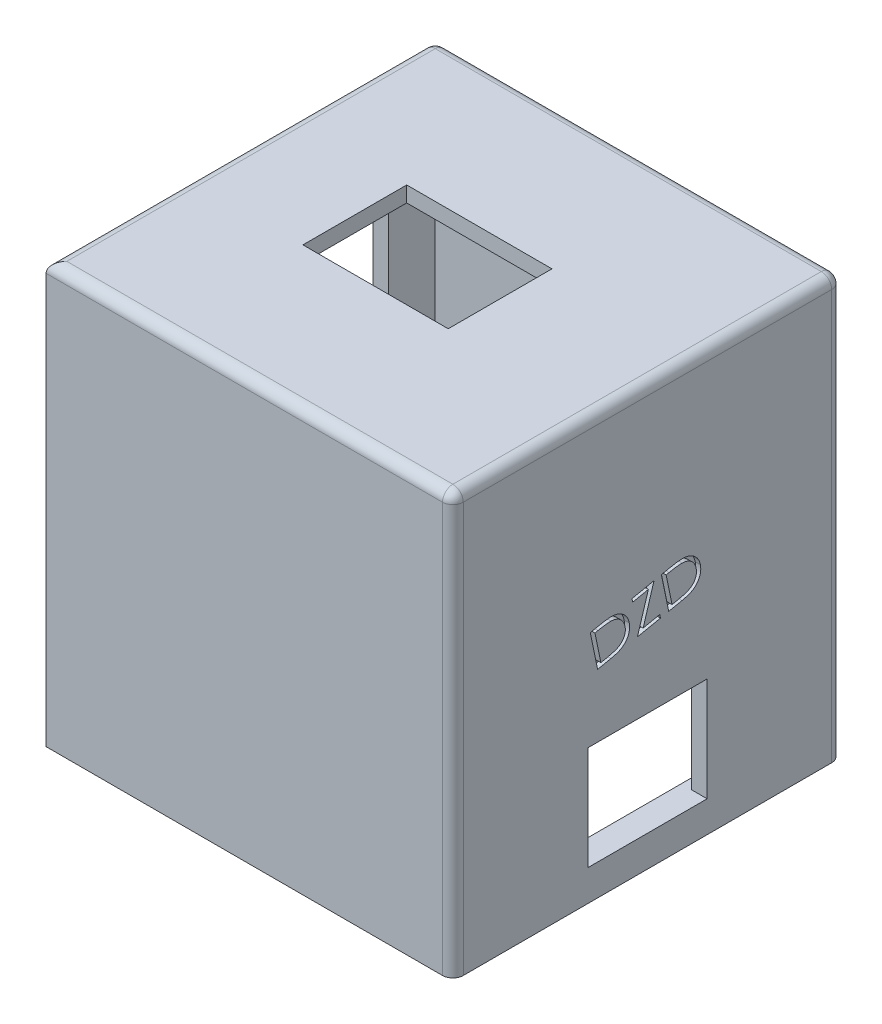
from build123d import *

# Parameters (mm, degrees)
SKETCH_1_W               = 39.2
SKETCH_1_H               = 37.5
EXTRUDE_1_DEPTH          = 40.5
SHELL_1_T                = -1.5
SKETCH_4_W               = 14
SKETCH_4_H               = 10
CUT_EXTRUDE_1_DEPTH      = 1.5
SKETCH_5_W               = 25.5
SKETCH_5_H               = 18
CUT_EXTRUDE_2_DEPTH      = 5.5
SKETCH_6_W               = 11.5
SKETCH_6_H               = 10
CUT_EXTRUDE_3_DEPTH      = 5.5
SKETCH_12_W              = 36.2
SKETCH_12_H              = 34.5
SKETCH_12_W_2            = 34.2
SKETCH_12_H_2            = 32.5
EXTRUDE_4_DEPTH          = 1.5
SKETCH_13_R              = 0.9
EXTRUDE_5_DEPTH          = 1.5
WRAP_START               = -0.5
WRAP_1_DEPTH             = 0.5
FILLET_1_R               = 1
WRAP_2_DEPTH             = 0.5
HOLE_WIZARD_M1_6_2_D     = 1.25
HOLE_WIZARD_M1_6_2_DEPTH = 4.25
HOLE_WIZARD_M1_6_2_TIP   = 0.375537887


# Read off the part's stored shape, not the designer's step: 包覆1, 包覆2
with BuildPart() as part:
    # 草图1 → 凸台-拉伸1 (new body)
    with BuildSketch(Plane(origin=(0, 0, 0), x_dir=(1, 0, 0), z_dir=(0, 1, 0))):
        Rectangle(SKETCH_1_W, SKETCH_1_H)
    extrude(amount=EXTRUDE_1_DEPTH)

    # 抽壳1
    shell_1_openings = [part.faces().sort_by_distance(p)[0] for p in [
        (0, 0, 0),
    ]]
    offset(amount=SHELL_1_T, openings=shell_1_openings, kind=Kind.INTERSECTION)

    # 草图4 → 切除-拉伸1 (cut)
    with BuildSketch(Plane(origin=(0, 40.5, 0), x_dir=(1, 0, 0), z_dir=(0, 1, 0))):
        with Locations((-1.6, 0)):
            Rectangle(SKETCH_4_W, SKETCH_4_H)
    extrude(amount=-CUT_EXTRUDE_1_DEPTH, mode=Mode.SUBTRACT)

    # 草图5 → 切除-拉伸2 (cut)
    with BuildSketch(Plane.ZY.offset(19.6)):
        with Locations((0, 24.5)):
            Rectangle(SKETCH_5_W, SKETCH_5_H)
    extrude(amount=-CUT_EXTRUDE_2_DEPTH, mode=Mode.SUBTRACT)

    # 草图6 → 切除-拉伸3 (cut)
    with BuildSketch(Plane(origin=(19.6, 0, 0), x_dir=(0, 0, -1), z_dir=(1, 0, 0))):
        with Locations((0, 8)):
            Rectangle(SKETCH_6_W, SKETCH_6_H)
    extrude(amount=-CUT_EXTRUDE_3_DEPTH, mode=Mode.SUBTRACT)

    # 草图12 → 凸台-拉伸4 (add)
    with BuildSketch(Plane(origin=(0, 1.5, 0), x_dir=(-1, 0, 0), z_dir=(0, 1, 0))):
        Rectangle(SKETCH_12_W, SKETCH_12_H)
        Rectangle(SKETCH_12_W_2, SKETCH_12_H_2, mode=Mode.SUBTRACT)
    extrude(amount=EXTRUDE_4_DEPTH)

    # 草图13 → 凸台-拉伸5 (add)
    with BuildSketch(Plane(origin=(0, 1.5, 0), x_dir=(-1, 0, 0), z_dir=(0, 1, 0))):
        with Locations((17.1, 16.25)):
            Circle(SKETCH_13_R)
        with Locations((-17.1, 16.25)):
            Circle(SKETCH_13_R)
        with Locations((-17.1, -16.25)):
            Circle(SKETCH_13_R)
        with Locations((17.1, -16.25)):
            Circle(SKETCH_13_R)
    extrude(amount=EXTRUDE_5_DEPTH)

    # 包覆1 outline → 包覆1 (cut)
    # profile 1 of 11: a face of its own
    with BuildSketch(Plane.ZY.offset(19.6).offset(WRAP_START)):
        with BuildLine():
            add(Edge.make_bspline(
                [(2.708361644, 9.748047717), (2.755102772, 9.747892131), (2.844850917, 9.747593389), (2.973424187, 9.745927626), (3.090251284, 9.74115327), (3.195271123, 9.737044687), (3.288481778, 9.729552746), (3.370169069, 9.722392099), (3.439956766, 9.713018438), (3.482202618, 9.704313015), (3.501330394, 9.700371435)],
                knots=[0, 0, 0, 0, 0.176257755, 0.338434414, 0.484822051, 0.617157578, 0.734698361, 0.837385184, 0.926372421, 1, 1, 1, 1], degree=3))
            Line((2.708361644, 9.748047717), (2.007940971, 9.748047717))
            Line((2.007940971, 9.748047717), (2.007940971, 6.248047717))
            Line((2.007940971, 6.248047717), (2.322043535, 6.248047717))
            Line((2.322043535, 6.248047717), (2.322043535, 7.863432333))
            Line((2.322043535, 7.863432333), (2.577251868, 7.863432333))
            Line((2.577251868, 7.863432333), (3.86310924, 6.248047717))
            Line((3.86310924, 6.248047717), (4.251530714, 6.248047717))
            Line((4.251530714, 6.248047717), (2.965673342, 7.863432333))
            add(Edge.make_bspline(
                [(4.206658919, 8.812050121), (4.205189921, 8.765415017), (4.202323525, 8.674417849), (4.175598422, 8.542356967), (4.131821902, 8.419167653), (4.071498613, 8.305005015), (3.994679137, 8.202094369), (3.902354346, 8.111703914), (3.794472735, 8.036064002), (3.694043419, 7.983611197), (3.605329219, 7.950018288), (3.532295906, 7.926381929), (3.452628929, 7.908119964), (3.367091594, 7.891759832), (3.275327939, 7.879408138), (3.177557899, 7.870361543), (3.073711748, 7.864707495), (3.002372678, 7.86386549), (2.965673342, 7.863432333)],
                knots=[0, 0, 0, 0, 0.078780236, 0.153720644, 0.22671353, 0.299191166, 0.371189997, 0.443006414, 0.516689173, 0.593217217, 0.633872918, 0.676989142, 0.722899506, 0.771958611, 0.824211323, 0.879378651, 0.937948119, 1, 1, 1, 1], degree=3))
            add(Edge.make_bspline(
                [(3.501330394, 9.700371435), (3.526937018, 9.69404467), (3.577604007, 9.681526106), (3.650554073, 9.655066506), (3.720068397, 9.624446881), (3.785858222, 9.588483161), (3.847594013, 9.546908381), (3.905912324, 9.500440258), (3.961077787, 9.449333053), (4.010859417, 9.392298211), (4.057798469, 9.332461702), (4.097387095, 9.267757945), (4.131513575, 9.200096417), (4.158684092, 9.128788999), (4.180562065, 9.054527228), (4.195988305, 8.976638431), (4.205239492, 8.895477456), (4.206181348, 8.840119547), (4.206658919, 8.812050121)],
                knots=[0, 0, 0, 0, 0.064216843, 0.127063766, 0.188744538, 0.249132103, 0.309452533, 0.369826676, 0.430650142, 0.492351932, 0.554072106, 0.615689784, 0.676797703, 0.738439048, 0.80131691, 0.865184512, 0.931641324, 1, 1, 1, 1], degree=3))
        make_face()
        with BuildLine():
            add(Edge.make_bspline(
                [(2.962868855, 8.217498839), (2.992788894, 8.217485603), (3.050782451, 8.217459946), (3.134683116, 8.221453722), (3.212803228, 8.225997041), (3.28484398, 8.232946386), (3.350837555, 8.241902458), (3.410750968, 8.253105442), (3.46468202, 8.266157505), (3.527580559, 8.286359131), (3.59781709, 8.318365149), (3.67414855, 8.364930648), (3.739150888, 8.423499767), (3.79406875, 8.490473223), (3.838198181, 8.564109472), (3.869310236, 8.643525841), (3.889052678, 8.726717439), (3.891381224, 8.783895547), (3.892556355, 8.812751243)],
                knots=[0, 0, 0, 0, 0.07166815, 0.138913286, 0.20118457, 0.259124428, 0.312255041, 0.36068151, 0.405086143, 0.445101659, 0.51877778, 0.589461579, 0.658462242, 0.727283218, 0.796322487, 0.863174893, 0.930949381, 1, 1, 1, 1], degree=3))
            Line((2.962868855, 8.217498839), (2.322043535, 8.222406692))
            Line((2.322043535, 8.222406692), (2.322043535, 9.389073358))
            Line((2.322043535, 9.389073358), (2.978293535, 9.389073358))
            add(Edge.make_bspline(
                [(3.892556355, 8.812751243), (3.891354234, 8.840897817), (3.888972069, 8.896674055), (3.8695233, 8.978329966), (3.836633919, 9.055396916), (3.792311681, 9.127561401), (3.738312526, 9.193067137), (3.674994713, 9.24911429), (3.604089518, 9.295363754), (3.53781832, 9.324918135), (3.478584107, 9.343037988), (3.427154447, 9.355789152), (3.369042969, 9.366033621), (3.303967511, 9.374241682), (3.23220588, 9.381296626), (3.153395229, 9.386048405), (3.068058449, 9.388862269), (3.008911518, 9.389001358), (2.978293535, 9.389073358)],
                knots=[0, 0, 0, 0, 0.068814296, 0.136364825, 0.204019354, 0.273063739, 0.34291332, 0.410965444, 0.479168767, 0.549308007, 0.587651576, 0.630646669, 0.678878786, 0.731934299, 0.791111423, 0.85528319, 0.925085939, 1, 1, 1, 1], degree=3))
        make_face(mode=Mode.SUBTRACT)
    # profile 2 of 11: a face of its own
    with BuildSketch(Plane.ZY.offset(19.6).offset(WRAP_START)):
        with BuildLine():
            add(Edge.make_bspline(
                [(9.271562765, 8.895483615), (9.251956877, 8.918849585), (9.21300943, 8.9652665), (9.150350228, 9.030446045), (9.085048585, 9.091511306), (9.017129464, 9.148753186), (8.945370344, 9.200169952), (8.871509545, 9.248441055), (8.7943115, 9.291708793), (8.687559766, 9.344171779), (8.547911917, 9.398917934), (8.372117078, 9.444821165), (8.18860598, 9.474042341), (8.06340838, 9.477207182), (7.999727829, 9.478816948)],
                knots=[0, 0, 0, 0, 0.063163259, 0.125474941, 0.18712122, 0.248294346, 0.309294856, 0.369850066, 0.430973376, 0.49245599, 0.616147966, 0.740843698, 0.868182649, 1, 1, 1, 1], degree=3))
            Line((9.271562765, 8.895483615), (9.546402509, 9.105820153))
            add(Edge.make_bspline(
                [(8.01935924, 9.837791307), (8.059573712, 9.837309169), (8.139174209, 9.836354825), (8.256926861, 9.827048683), (8.371569188, 9.811535077), (8.48318017, 9.790419007), (8.592302787, 9.764211685), (8.698103027, 9.730071387), (8.801201714, 9.691034856), (8.900948623, 9.64607639), (8.996865173, 9.595609648), (9.088921491, 9.540194025), (9.17638635, 9.479898219), (9.259875198, 9.415235044), (9.337991409, 9.344836485), (9.412952888, 9.270638889), (9.482213966, 9.190505064), (9.524967161, 9.134100131), (9.546402509, 9.105820153)],
                knots=[0, 0, 0, 0, 0.068547537, 0.135682946, 0.20121499, 0.265682235, 0.329266835, 0.392395428, 0.455069762, 0.51712685, 0.578790035, 0.639739863, 0.700191504, 0.759806243, 0.819628319, 0.879354791, 0.939511608, 1, 1, 1, 1], degree=3))
            add(Edge.make_bspline(
                [(6.136146099, 8.018380249), (6.137701292, 8.081335703), (6.140761039, 8.205196628), (6.166756834, 8.386970581), (6.20857563, 8.56112198), (6.267972519, 8.727325724), (6.34327787, 8.886456005), (6.436304484, 9.037297209), (6.545971626, 9.180814009), (6.671419194, 9.31482876), (6.808986529, 9.437368113), (6.956305343, 9.545174317), (7.11308729, 9.634891833), (7.277605142, 9.709887995), (7.451090823, 9.767532458), (7.633174192, 9.807885645), (7.823513107, 9.833002761), (7.953375533, 9.836177969), (8.01935924, 9.837791307)],
                knots=[0, 0, 0, 0, 0.064557846, 0.127013532, 0.18795481, 0.248013913, 0.307747682, 0.368234515, 0.429469844, 0.492743437, 0.556257769, 0.618216786, 0.679655476, 0.741245546, 0.803415265, 0.866815462, 0.932328312, 1, 1, 1, 1], degree=3))
            add(Edge.make_bspline(
                [(6.579956195, 6.770383455), (6.544520551, 6.813924644), (6.474077075, 6.900481354), (6.383951391, 7.040767335), (6.306803836, 7.187235544), (6.244427915, 7.340655473), (6.195665182, 7.50068286), (6.161883987, 7.667398374), (6.139932382, 7.840646317), (6.137422094, 7.958483105), (6.136146099, 8.018380249)],
                knots=[0, 0, 0, 0, 0.12432851, 0.247156016, 0.368779749, 0.490733862, 0.613613772, 0.738957576, 0.867310575, 1, 1, 1, 1], degree=3))
            add(Edge.make_bspline(
                [(8.023565971, 6.158304128), (7.985922303, 6.15856612), (7.911486613, 6.159084178), (7.801587862, 6.167476345), (7.694598281, 6.178926082), (7.590823655, 6.196166213), (7.48969768, 6.216510554), (7.392137096, 6.24378181), (7.297181885, 6.274330977), (7.205213544, 6.310235963), (7.116153845, 6.350752146), (7.030290033, 6.396543705), (6.947661601, 6.44722557), (6.86745618, 6.50168058), (6.790858596, 6.561657882), (6.717205071, 6.626324516), (6.646082595, 6.695462527), (6.60207991, 6.74531738), (6.579956195, 6.770383455)],
                knots=[0, 0, 0, 0, 0.069662801, 0.137749562, 0.203916744, 0.268779862, 0.332413706, 0.39475354, 0.456180032, 0.516995649, 0.577395938, 0.637198344, 0.696999184, 0.756756194, 0.816553905, 0.876947997, 0.938131788, 1, 1, 1, 1], degree=3))
            add(Edge.make_bspline(
                [(9.546402509, 6.892378647), (9.524284399, 6.863840195), (9.480154124, 6.806899989), (9.408696107, 6.726628279), (9.333418809, 6.651124243), (9.253763099, 6.580996622), (9.170645308, 6.514842157), (9.082572996, 6.454540325), (8.990703963, 6.399249441), (8.895349484, 6.348622517), (8.796610871, 6.30370527), (8.694606436, 6.265251502), (8.589775861, 6.232126612), (8.482114352, 6.204874676), (8.371398596, 6.183603592), (8.258028122, 6.169383917), (8.141758246, 6.159642002), (8.063316825, 6.158754087), (8.023565971, 6.158304128)],
                knots=[0, 0, 0, 0, 0.061674239, 0.123053062, 0.183475001, 0.243726501, 0.304278917, 0.364862921, 0.425946204, 0.48739123, 0.549220384, 0.611143589, 0.67352853, 0.736961457, 0.800785283, 0.866012596, 0.932100748, 1, 1, 1, 1], degree=3))
            Line((9.546402509, 6.892378647), (9.271562765, 7.10061182))
            add(Edge.make_bspline(
                [(8.021462605, 6.517278487), (8.082565294, 6.518967266), (8.202830003, 6.522291189), (8.379198029, 6.550450438), (8.548033795, 6.596108356), (8.709346382, 6.660006278), (8.862681028, 6.743071566), (9.008277688, 6.843769444), (9.146259259, 6.963057776), (9.229230541, 7.054140905), (9.271562765, 7.10061182)],
                knots=[0, 0, 0, 0, 0.12851519, 0.252948636, 0.374754734, 0.495939754, 0.617180641, 0.740909469, 0.867811148, 1, 1, 1, 1], degree=3))
            add(Edge.make_bspline(
                [(6.450248663, 7.994542108), (6.451510482, 7.942810789), (6.453987896, 7.841243204), (6.47603623, 7.692472593), (6.509541322, 7.549951919), (6.559756898, 7.414572077), (6.621675949, 7.284663719), (6.699916561, 7.162424866), (6.790533098, 7.046008301), (6.894807517, 6.938165353), (7.009213333, 6.839651628), (7.131961245, 6.752901047), (7.262745533, 6.680586164), (7.400122163, 6.620410218), (7.545148277, 6.57415349), (7.697563079, 6.541589366), (7.857035074, 6.520347186), (7.966004474, 6.518313498), (8.021462605, 6.517278487)],
                knots=[0, 0, 0, 0, 0.064323217, 0.126290104, 0.186726469, 0.246146432, 0.305575643, 0.365429386, 0.426326309, 0.488839906, 0.551724972, 0.613918596, 0.675483766, 0.737333897, 0.800229044, 0.864502298, 0.931040739, 1, 1, 1, 1], degree=3))
            add(Edge.make_bspline(
                [(7.999727829, 9.478816948), (7.96464453, 9.478412986), (7.894803538, 9.47760881), (7.791155064, 9.466999685), (7.689442013, 9.452088475), (7.589730547, 9.429963151), (7.492147588, 9.401990532), (7.396055186, 9.368565118), (7.302844586, 9.327210278), (7.211226348, 9.281502019), (7.123447137, 9.229874574), (7.040392089, 9.173561222), (6.962364121, 9.113192125), (6.889301509, 9.048541019), (6.821129561, 8.979899059), (6.75834225, 8.906534717), (6.70115684, 8.828682543), (6.648439815, 8.747369136), (6.601227081, 8.662831344), (6.561697202, 8.574756274), (6.52669208, 8.484652171), (6.498992837, 8.39150101), (6.47706832, 8.295958244), (6.461940657, 8.197767456), (6.451452186, 8.097133777), (6.450652009, 8.028924464), (6.450248663, 7.994542108)],
                knots=[0, 0, 0, 0, 0.043954909, 0.087501875, 0.130462627, 0.172752021, 0.215403067, 0.25764983, 0.300152749, 0.34312149, 0.385925163, 0.427685727, 0.46881795, 0.5094918, 0.549883031, 0.589980023, 0.63040523, 0.670868626, 0.711383944, 0.751627258, 0.791775577, 0.832458919, 0.873319045, 0.914542956, 0.956923558, 1, 1, 1, 1], degree=3))
        make_face()
    # profile 3 of 11: a face of its own
    with BuildSketch(Plane.ZY.offset(19.6).offset(WRAP_START)):
        with BuildLine():
            add(Edge.make_bspline(
                [(10.578453791, 7.650992429), (10.578407047, 7.621311693), (10.578318342, 7.564987382), (10.578910856, 7.484819082), (10.580570225, 7.413546623), (10.581616384, 7.350895275), (10.583943718, 7.297152528), (10.585841765, 7.252027217), (10.588282321, 7.215733015), (10.591215439, 7.194552088), (10.592476227, 7.185447557)],
                knots=[0, 0, 0, 0, 0.191078592, 0.362604556, 0.51609875, 0.650038026, 0.765976721, 0.862374026, 0.940842058, 1, 1, 1, 1], degree=3))
            Line((10.578453791, 7.650992429), (10.578453791, 9.748047717))
            Line((10.578453791, 9.748047717), (10.264351227, 9.748047717))
            Line((10.264351227, 9.748047717), (10.264351227, 7.634165506))
            add(Edge.make_bspline(
                [(10.326751067, 6.896585378), (10.321573908, 6.915217952), (10.310344537, 6.955632421), (10.298319239, 7.02251891), (10.288210158, 7.099533827), (10.2787046, 7.186682446), (10.273095642, 7.284032312), (10.268178203, 7.391541228), (10.264316584, 7.50933919), (10.264339357, 7.591393705), (10.264351227, 7.634165506)],
                knots=[0, 0, 0, 0, 0.078129865, 0.169465417, 0.274335291, 0.392110163, 0.52368733, 0.668365421, 0.827131902, 1, 1, 1, 1], degree=3))
            add(Edge.make_bspline(
                [(11.420501067, 6.158304128), (11.386831964, 6.159088893), (11.320773305, 6.1606286), (11.223435238, 6.16945135), (11.130121042, 6.186069744), (11.039845165, 6.207229688), (10.953836667, 6.236413425), (10.870943223, 6.27051155), (10.792584542, 6.31238881), (10.717489413, 6.358982203), (10.647664657, 6.411406841), (10.583567254, 6.468547015), (10.525091383, 6.529487393), (10.473222687, 6.594887758), (10.427101803, 6.664239465), (10.387371589, 6.737738705), (10.353258345, 6.815357021), (10.335651778, 6.869310222), (10.326751067, 6.896585378)],
                knots=[0, 0, 0, 0, 0.071174504, 0.139644122, 0.206317224, 0.27137324, 0.335418084, 0.398076345, 0.460607915, 0.522969511, 0.584715724, 0.64489494, 0.704290561, 0.76299819, 0.821087431, 0.880103891, 0.939388488, 1, 1, 1, 1], degree=3))
            add(Edge.make_bspline(
                [(12.507940971, 7.634165506), (12.50768685, 7.596067127), (12.507190919, 7.521715824), (12.502890342, 7.412764465), (12.496033342, 7.309411484), (12.486345254, 7.211642987), (12.473508251, 7.119808828), (12.459233031, 7.03310406), (12.441053498, 6.952151067), (12.419820097, 6.876318649), (12.395546548, 6.804133136), (12.3641054, 6.735624521), (12.3286809, 6.668710122), (12.286666247, 6.604402013), (12.239454865, 6.54241546), (12.186003184, 6.483126385), (12.128079023, 6.425587338), (12.064719463, 6.371274272), (11.996968938, 6.321465595), (11.92502898, 6.277667824), (11.849452211, 6.240644207), (11.770435085, 6.210168282), (11.687943882, 6.187253683), (11.601976522, 6.170178527), (11.512337329, 6.16047623), (11.451372672, 6.1590343), (11.420501067, 6.158304128)],
                knots=[0, 0, 0, 0, 0.054858035, 0.107058792, 0.156978355, 0.203992277, 0.248491536, 0.290483314, 0.330489004, 0.367885926, 0.403858131, 0.440009343, 0.476295011, 0.512792295, 0.550484825, 0.588381116, 0.627645327, 0.667979464, 0.708432758, 0.748602302, 0.789087777, 0.829461205, 0.870371045, 0.912214227, 0.955546575, 1, 1, 1, 1], degree=3))
            Line((12.507940971, 7.634165506), (12.507940971, 9.748047717))
            Line((12.507940971, 9.748047717), (12.193838406, 9.748047717))
            Line((12.193838406, 9.748047717), (12.193838406, 7.650992429))
            add(Edge.make_bspline(
                [(12.158081195, 7.107623038), (12.16108132, 7.119971612), (12.167766808, 7.147489212), (12.174013853, 7.194010503), (12.180520379, 7.248899867), (12.185034949, 7.31255168), (12.189436169, 7.384752652), (12.192069242, 7.46587891), (12.193286275, 7.555635871), (12.193648955, 7.618273032), (12.193838406, 7.650992429)],
                knots=[0, 0, 0, 0, 0.069835104, 0.155620755, 0.257801557, 0.373811234, 0.506402493, 0.655564458, 0.820079282, 1, 1, 1, 1], degree=3))
            add(Edge.make_bspline(
                [(11.402973022, 6.517278487), (11.431526762, 6.518352337), (11.488469324, 6.520493835), (11.573075755, 6.533755266), (11.655475863, 6.557655832), (11.736076543, 6.58849559), (11.811627528, 6.629243181), (11.88217097, 6.676314021), (11.945134904, 6.731524897), (12.002592902, 6.792625241), (12.052627838, 6.861565041), (12.095998979, 6.936843179), (12.131524909, 7.019592526), (12.149068434, 7.077746949), (12.158081195, 7.107623038)],
                knots=[0, 0, 0, 0, 0.082890648, 0.165302541, 0.247761876, 0.331527711, 0.415279813, 0.49636623, 0.577151348, 0.65778254, 0.739321642, 0.823793082, 0.909475953, 1, 1, 1, 1], degree=3))
            add(Edge.make_bspline(
                [(10.592476227, 7.185447557), (10.597653686, 7.152600794), (10.607716872, 7.088758065), (10.63336325, 6.997849783), (10.669180751, 6.915918325), (10.711623794, 6.840407033), (10.767556405, 6.773417673), (10.83455994, 6.711706021), (10.915737709, 6.657734216), (11.005998314, 6.608383404), (11.103283552, 6.568718322), (11.202694818, 6.538724957), (11.302737797, 6.520446058), (11.369713963, 6.518329519), (11.402973022, 6.517278487)],
                knots=[0, 0, 0, 0, 0.086315004, 0.167766466, 0.244432684, 0.318134662, 0.391884107, 0.47006805, 0.553904179, 0.644339498, 0.736874663, 0.826168364, 0.913678595, 1, 1, 1, 1], degree=3))
        make_face()
    # profile 4 of 11: a face of its own
    with BuildSketch(Plane.ZY.offset(19.6).offset(WRAP_START)):
        with BuildLine():
            add(Edge.make_bspline(
                [(14.088269496, 9.748047717), (14.121697974, 9.747871967), (14.186490685, 9.747531319), (14.280710127, 9.742248188), (14.368958937, 9.735044518), (14.45126271, 9.723614425), (14.527583412, 9.709822648), (14.598151049, 9.693120832), (14.662741221, 9.673094218), (14.739853958, 9.641247937), (14.827774619, 9.593924769), (14.922973011, 9.523996204), (15.004377251, 9.438463741), (15.074563568, 9.341981085), (15.130364688, 9.235845313), (15.170733985, 9.122586125), (15.19629186, 9.003664383), (15.198920294, 8.922021205), (15.200248663, 8.880760057)],
                knots=[0, 0, 0, 0, 0.062594097, 0.121322939, 0.176680142, 0.228365096, 0.276868446, 0.321879128, 0.364098625, 0.403355696, 0.477967948, 0.550535461, 0.623584457, 0.698174882, 0.77335367, 0.847281125, 0.92281834, 1, 1, 1, 1], degree=3))
            Line((14.088269496, 9.748047717), (13.405376868, 9.748047717))
            Line((13.405376868, 9.748047717), (13.405376868, 6.248047717))
            Line((13.405376868, 6.248047717), (14.351891291, 6.248047717))
            add(Edge.make_bspline(
                [(15.469479432, 7.241537301), (15.468502586, 7.207370429), (15.466580614, 7.140146151), (15.452400642, 7.041391016), (15.428391535, 6.947016069), (15.395320389, 6.856410887), (15.352158074, 6.769750752), (15.29963011, 6.686937488), (15.236998546, 6.608803158), (15.166935677, 6.534479534), (15.087673532, 6.467651747), (15.002157777, 6.40813604), (14.909311457, 6.359189978), (14.810659463, 6.318073957), (14.705095147, 6.286666758), (14.59309254, 6.264694184), (14.474748238, 6.249889147), (14.393538487, 6.248671943), (14.351891291, 6.248047717)],
                knots=[0, 0, 0, 0, 0.061160277, 0.120334558, 0.178180255, 0.235235126, 0.292682961, 0.351186248, 0.41045661, 0.471719854, 0.533761203, 0.595739024, 0.657887515, 0.72129518, 0.786822515, 0.854686154, 0.925477986, 1, 1, 1, 1], degree=3))
            add(Edge.make_bspline(
                [(14.795701387, 8.136168711), (14.835461815, 8.120903712), (14.911533362, 8.091697988), (15.016219375, 8.040062524), (15.10641422, 7.983900413), (15.182811366, 7.922568563), (15.24814902, 7.856459752), (15.305201962, 7.784604638), (15.353883336, 7.70606588), (15.39559626, 7.621662345), (15.428145016, 7.532255877), (15.45252092, 7.4386851), (15.466488369, 7.341285545), (15.468476011, 7.275000166), (15.469479432, 7.241537301)],
                knots=[0, 0, 0, 0, 0.106057493, 0.202914257, 0.290300165, 0.370222566, 0.446383721, 0.5213969, 0.598291083, 0.676142469, 0.7555287, 0.834887172, 0.916646049, 1, 1, 1, 1], degree=3))
            add(Edge.make_bspline(
                [(15.200248663, 8.880760057), (15.199155444, 8.842107501), (15.197007167, 8.766151584), (15.176464408, 8.655057475), (15.144303739, 8.549306256), (15.09959849, 8.449283871), (15.041496494, 8.357250258), (14.972638175, 8.272462992), (14.889561373, 8.198511935), (14.827318133, 8.157169032), (14.795701387, 8.136168711)],
                knots=[0, 0, 0, 0, 0.130569107, 0.256580609, 0.380551617, 0.503622917, 0.625739323, 0.747548582, 0.871766119, 1, 1, 1, 1], degree=3))
        make_face()
        with BuildLine():
            add(Edge.make_bspline(
                [(14.166795137, 6.607022076), (14.198814063, 6.607405824), (14.260526322, 6.608145446), (14.349627552, 6.610560001), (14.432210656, 6.616052277), (14.507898791, 6.624698126), (14.577509244, 6.634076575), (14.640206947, 6.646687856), (14.69650014, 6.661136817), (14.761774448, 6.683470989), (14.835277956, 6.71816746), (14.914488813, 6.770481686), (14.984915031, 6.832804994), (15.04472029, 6.904935908), (15.093733279, 6.983367235), (15.129388734, 7.066512585), (15.151379591, 7.152998113), (15.15404176, 7.211964825), (15.155376868, 7.241537301)],
                knots=[0, 0, 0, 0, 0.072502489, 0.139738989, 0.201795135, 0.259821934, 0.312205989, 0.360773434, 0.404540343, 0.443698099, 0.516840794, 0.587874336, 0.657965418, 0.728969389, 0.79930772, 0.866635778, 0.933116329, 1, 1, 1, 1], degree=3))
            Line((14.166795137, 6.607022076), (13.719479432, 6.607022076))
            Line((13.719479432, 6.607022076), (13.719479432, 7.908304128))
            Line((13.719479432, 7.908304128), (13.927712605, 7.908304128))
            add(Edge.make_bspline(
                [(14.582560362, 7.866937942), (14.565531266, 7.870393026), (14.528608673, 7.87788436), (14.468401093, 7.885792064), (14.399665224, 7.892837124), (14.322242347, 7.898048281), (14.236034506, 7.903434825), (14.140857587, 7.905529646), (14.037100272, 7.908028906), (13.9651079, 7.90821004), (13.927712605, 7.908304128)],
                knots=[0, 0, 0, 0, 0.079306486, 0.171952819, 0.277056507, 0.394730576, 0.526177321, 0.671344767, 0.829285257, 1, 1, 1, 1], degree=3))
            add(Edge.make_bspline(
                [(15.155376868, 7.241537301), (15.155100764, 7.260030641), (15.154553009, 7.296719023), (15.146292394, 7.350634842), (15.134278524, 7.402860716), (15.11874709, 7.453538456), (15.096127623, 7.501751832), (15.069721078, 7.548454392), (15.038759676, 7.593707871), (14.99051551, 7.650920125), (14.920343526, 7.716837138), (14.82063675, 7.78137464), (14.707264452, 7.833422447), (14.625036959, 7.855521923), (14.582560362, 7.866937942)],
                knots=[0, 0, 0, 0, 0.060287398, 0.119602355, 0.177503371, 0.235142664, 0.292132593, 0.350871209, 0.410097863, 0.470731522, 0.594828704, 0.722578824, 0.85669139, 1, 1, 1, 1], degree=3))
        make_face(mode=Mode.SUBTRACT)
        with BuildLine():
            add(Edge.make_bspline(
                [(13.930517092, 8.267278487), (13.961365888, 8.26767841), (14.020972047, 8.268451142), (14.107291943, 8.270664659), (14.187416962, 8.276862703), (14.261208795, 8.283058965), (14.328551239, 8.293133553), (14.3892951, 8.305125676), (14.444393697, 8.317808581), (14.507933243, 8.339378068), (14.580006191, 8.371255743), (14.656839295, 8.420727579), (14.724573765, 8.479651932), (14.781770953, 8.547642894), (14.828582423, 8.62250908), (14.861096138, 8.70305596), (14.883143422, 8.787276092), (14.885134954, 8.845094345), (14.886146099, 8.874449961)],
                knots=[0, 0, 0, 0, 0.072301034, 0.139700332, 0.202288511, 0.260599533, 0.313190329, 0.361738933, 0.405706476, 0.445539985, 0.518831956, 0.58977824, 0.658867479, 0.728430478, 0.797282704, 0.864815377, 0.931363753, 1, 1, 1, 1], degree=3))
            Line((13.930517092, 8.267278487), (13.719479432, 8.267278487))
            Line((13.719479432, 8.267278487), (13.719479432, 9.389073358))
            Line((13.719479432, 9.389073358), (14.145761483, 9.389073358))
            add(Edge.make_bspline(
                [(14.886146099, 8.874449961), (14.885619919, 8.893875733), (14.884587759, 8.931981505), (14.876134456, 8.987530859), (14.861766882, 9.039774611), (14.843312588, 9.089428722), (14.8175239, 9.134940572), (14.787160436, 9.177883768), (14.750474746, 9.216795886), (14.708717433, 9.253165384), (14.660708811, 9.285409912), (14.606477519, 9.313650675), (14.545289842, 9.336391452), (14.478176987, 9.356307604), (14.404105899, 9.370295898), (14.323931346, 9.381949286), (14.236996627, 9.387882028), (14.176851524, 9.388667391), (14.145761483, 9.389073358)],
                knots=[0, 0, 0, 0, 0.057003133, 0.111817869, 0.164402372, 0.215869805, 0.26684111, 0.317478963, 0.369902136, 0.423400449, 0.479718398, 0.539241497, 0.602430689, 0.671029546, 0.744484798, 0.823453971, 0.908740313, 1, 1, 1, 1], degree=3))
        make_face(mode=Mode.SUBTRACT)
    # profile 5 of 11: a face of its own
    with BuildSketch(Plane.ZY.offset(19.6).offset(WRAP_START)):
        Polygon((-14.854739318, 9.748047717), (-15.873469286, 7.181240826), (-16.558465279, 9.748047717), (-16.883084671, 9.748047717), (-15.951994927, 6.248047717), (-15.907123132, 6.248047717), (-14.841418004, 8.92493073), (-13.788333068, 6.248047717), (-13.743461273, 6.248047717), (-12.799751337, 9.748047717), (-13.120865119, 9.748047717), (-13.809366722, 7.198768871), (-14.809166401, 9.748047717), align=None)
    # profile 6 of 11: a face of its own
    with BuildSketch(Plane.ZY.offset(19.6).offset(WRAP_START)):
        Polygon((-10.197187235, 9.389073358), (-10.197187235, 9.748047717), (-12.171546209, 9.748047717), (-12.171546209, 6.248047717), (-10.197187235, 6.248047717), (-10.197187235, 6.607022076), (-11.857443645, 6.607022076), (-11.857443645, 7.953175923), (-10.197187235, 7.953175923), (-10.197187235, 8.312150282), (-11.857443645, 8.312150282), (-11.857443645, 9.389073358), align=None)
    # profile 7 of 11: a face of its own
    with BuildSketch(Plane.ZY.offset(19.6).offset(WRAP_START)):
        Polygon((-6.517700055, 6.248047717), (-8.133084671, 9.748047717), (-8.177956465, 9.748047717), (-9.838212876, 6.248047717), (-9.495364318, 6.248047717), (-8.963212876, 7.369842589), (-7.376574254, 7.369842589), (-6.859146369, 6.248047717), align=None)
        Polygon((-8.159026177, 9.065856211), (-7.542038997, 7.728816948), (-8.792840279, 7.728816948), align=None, mode=Mode.SUBTRACT)
    # profile 8 of 11: a face of its own
    with BuildSketch(Plane.ZY.offset(19.6).offset(WRAP_START)):
        Polygon((-4.453597491, 9.389073358), (-4.453597491, 9.748047717), (-6.293341081, 9.748047717), (-6.293341081, 9.389073358), (-5.530520568, 9.389073358), (-5.530520568, 6.248047717), (-5.216418004, 6.248047717), (-5.216418004, 9.389073358), align=None)
    # profile 9 of 11: a face of its own
    with BuildSketch(Plane.ZY.offset(19.6).offset(WRAP_START)):
        Polygon((-1.492059029, 6.248047717), (-1.492059029, 9.748047717), (-1.806161594, 9.748047717), (-1.806161594, 8.312150282), (-3.601033388, 8.312150282), (-3.601033388, 9.748047717), (-3.915135953, 9.748047717), (-3.915135953, 6.248047717), (-3.601033388, 6.248047717), (-3.601033388, 7.953175923), (-1.806161594, 7.953175923), (-1.806161594, 6.248047717), align=None)
    # profile 10 of 11: a face of its own
    with BuildSketch(Plane.ZY.offset(19.6).offset(WRAP_START)):
        Polygon((1.379735842, 9.389073358), (1.379735842, 9.748047717), (-0.594623132, 9.748047717), (-0.594623132, 6.248047717), (1.379735842, 6.248047717), (1.379735842, 6.607022076), (-0.280520568, 6.607022076), (-0.280520568, 7.953175923), (1.379735842, 7.953175923), (1.379735842, 8.312150282), (-0.280520568, 8.312150282), (-0.280520568, 9.389073358), align=None)
    # profile 11 of 11: a face of its own
    with BuildSketch(Plane.ZY.offset(19.6).offset(WRAP_START)):
        Polygon((18.161787124, 9.389073358), (18.161787124, 9.748047717), (16.18742815, 9.748047717), (16.18742815, 6.248047717), (18.161787124, 6.248047717), (18.161787124, 6.607022076), (16.501530714, 6.607022076), (16.501530714, 7.953175923), (18.161787124, 7.953175923), (18.161787124, 8.312150282), (16.501530714, 8.312150282), (16.501530714, 9.389073358), align=None)
    extrude(amount=WRAP_1_DEPTH, mode=Mode.SUBTRACT)

    # 圆角1
    fillet_1_edges = [part.edges().sort_by_distance(p)[0] for p in [
        (-19.6, 40.5, 0),
        (0, 40.5, 18.75),
        (-18.1, 21, 17.25),
        (19.6, 40.5, 0),
        (0, 40.5, -18.75),
        (19.6, 20.25, 18.75),
        (-19.6, 20.25, -18.75),
        (19.6, 20.25, -18.75),
    ]]
    fillet(fillet_1_edges, radius=FILLET_1_R)

    # 包覆2 outline → 包覆2 (cut)
    # profile 1 of 3: a face of its own
    with BuildSketch(Plane(origin=(19.6, 0, 0), x_dir=(0, 0, -1), z_dir=(1, 0, 0)).offset(WRAP_START)):
        with BuildLine():
            add(Edge.make_bspline(
                [(-4.676753785, 22.664920444), (-4.603911551, 22.679806099), (-4.463417246, 22.708516775), (-4.259378715, 22.743590491), (-4.070479757, 22.774082318), (-3.895938332, 22.795291159), (-3.73610882, 22.811637452), (-3.590826469, 22.819186377), (-3.460193358, 22.820959026), (-3.378260154, 22.815449235), (-3.339714522, 22.812857143)],
                knots=[0, 0, 0, 0, 0.16530579, 0.318833193, 0.460316731, 0.590712295, 0.709746237, 0.81746869, 0.914127797, 1, 1, 1, 1], degree=3))
            Line((-4.676753785, 22.664920444), (-5.512490965, 22.491743361))
            Line((-5.512490965, 22.491743361), (-4.805059074, 19.075176854))
            Line((-4.805059074, 19.075176854), (-3.523408433, 19.340200893))
            add(Edge.make_bspline(
                [(-1.75658151, 21.442865156), (-1.748405051, 21.4006703), (-1.732225809, 21.317176843), (-1.720400612, 21.191639311), (-1.715944697, 21.068483298), (-1.719776936, 20.947262641), (-1.733910682, 20.828167731), (-1.757339169, 20.711314905), (-1.788763947, 20.596578637), (-1.829434158, 20.484893778), (-1.877880166, 20.377080624), (-1.932566742, 20.274098913), (-1.992954827, 20.175827001), (-2.060417076, 20.08359831), (-2.133387498, 19.996129669), (-2.213126566, 19.914641588), (-2.298678012, 19.838058769), (-2.391289629, 19.766546353), (-2.493134798, 19.700001325), (-2.605352577, 19.63680303), (-2.730026952, 19.578223797), (-2.866131579, 19.523149332), (-3.013630621, 19.471007178), (-3.173282546, 19.424055903), (-3.343987104, 19.378654334), (-3.462524322, 19.353249529), (-3.523408433, 19.340200893)],
                knots=[0, 0, 0, 0, 0.041364291, 0.081849969, 0.121255463, 0.159986234, 0.198507223, 0.236595211, 0.274649278, 0.312948759, 0.350924891, 0.388374615, 0.425158489, 0.461889318, 0.498309989, 0.534753597, 0.571570499, 0.608795742, 0.647306869, 0.688619093, 0.732709528, 0.779848715, 0.829955825, 0.883283187, 0.940050901, 1, 1, 1, 1], degree=3))
            add(Edge.make_bspline(
                [(-3.339714522, 22.812857143), (-3.288906675, 22.807470698), (-3.188901424, 22.79686854), (-3.04262577, 22.769332981), (-2.902489153, 22.732076652), (-2.768618346, 22.685527942), (-2.641446231, 22.628113164), (-2.520762355, 22.561419408), (-2.405879531, 22.485515504), (-2.298092645, 22.400001523), (-2.198028949, 22.306154037), (-2.106139682, 22.205094044), (-2.024998625, 22.095539725), (-1.951334728, 21.979808928), (-1.888543463, 21.855775362), (-1.834293308, 21.725108216), (-1.789911582, 21.586864823), (-1.767820053, 21.491420303), (-1.75658151, 21.442865156)],
                knots=[0, 0, 0, 0, 0.067850832, 0.133551014, 0.197485389, 0.260324968, 0.321604485, 0.382606554, 0.443310857, 0.504305815, 0.56514651, 0.625375006, 0.685479351, 0.746031038, 0.807400927, 0.869898305, 0.933813833, 1, 1, 1, 1], degree=3))
        make_face()
        with BuildLine():
            add(Edge.make_bspline(
                [(-4.019802663, 19.573674451), (-3.952900732, 19.587650032), (-3.824456077, 19.614481676), (-3.640618023, 19.657553843), (-3.473174719, 19.699303625), (-3.322331957, 19.740480702), (-3.188113722, 19.781121629), (-3.070223672, 19.820593756), (-2.96873061, 19.860100436), (-2.907914122, 19.889089417), (-2.879778625, 19.902500572)],
                knots=[0, 0, 0, 0, 0.172422533, 0.331033084, 0.476323594, 0.607777108, 0.725471212, 0.830072459, 0.921386519, 1, 1, 1, 1], degree=3))
            Line((-4.019802663, 19.573674451), (-4.485347535, 19.477620765))
            Line((-4.485347535, 19.477620765), (-5.05746292, 22.239339515))
            Line((-5.05746292, 22.239339515), (-4.772807471, 22.298233745))
            add(Edge.make_bspline(
                [(-3.505880388, 22.458790636), (-3.541405851, 22.459956663), (-3.61762359, 22.462458304), (-3.739266338, 22.456202816), (-3.875834539, 22.445869538), (-4.02686283, 22.428736408), (-4.192583388, 22.405403143), (-4.372996623, 22.375661008), (-4.568209772, 22.34007925), (-4.702979654, 22.312515335), (-4.772807471, 22.298233745)],
                knots=[0, 0, 0, 0, 0.083287116, 0.178687488, 0.285284665, 0.4043452, 0.534892075, 0.677553363, 0.832931923, 1, 1, 1, 1], degree=3))
            add(Edge.make_bspline(
                [(-2.163933272, 21.353822688), (-2.173133111, 21.394181583), (-2.191239026, 21.473610662), (-2.228619688, 21.588369946), (-2.274366033, 21.69659293), (-2.327468408, 21.798625071), (-2.389193033, 21.893768866), (-2.457583388, 21.983380271), (-2.535630453, 22.06544311), (-2.619941451, 22.141813908), (-2.711536018, 22.210653732), (-2.808700312, 22.271770304), (-2.911841459, 22.32349199), (-3.019647414, 22.36826722), (-3.13351608, 22.403817345), (-3.252856555, 22.430957531), (-3.377508925, 22.450310659), (-3.462579798, 22.455930281), (-3.505880388, 22.458790636)],
                knots=[0, 0, 0, 0, 0.065852947, 0.129603126, 0.191774615, 0.25266459, 0.312399697, 0.372064128, 0.431793445, 0.492365657, 0.552917311, 0.613908303, 0.674788053, 0.736329989, 0.799499217, 0.86437118, 0.930965703, 1, 1, 1, 1], degree=3))
            add(Edge.make_bspline(
                [(-2.879778625, 19.902500572), (-2.844902681, 19.921164535), (-2.776351958, 19.957849654), (-2.680065505, 20.020564066), (-2.591385976, 20.08845269), (-2.508768958, 20.160034969), (-2.435466275, 20.238655105), (-2.367932145, 20.320674055), (-2.309299281, 20.408898435), (-2.257074434, 20.50118429), (-2.213927558, 20.598053774), (-2.178451473, 20.697499505), (-2.153086592, 20.800170039), (-2.137340212, 20.905563682), (-2.129079653, 21.013888972), (-2.132058524, 21.124998307), (-2.141752331, 21.239078762), (-2.156453498, 21.315129171), (-2.163933272, 21.353822688)],
                knots=[0, 0, 0, 0, 0.067708944, 0.13308592, 0.196475544, 0.25885417, 0.319998582, 0.380309696, 0.440576982, 0.50113453, 0.561676209, 0.621920905, 0.681707988, 0.742435862, 0.804219906, 0.867459038, 0.932564782, 1, 1, 1, 1], degree=3))
        make_face(mode=Mode.SUBTRACT)
    # profile 2 of 3: a face of its own
    with BuildSketch(Plane(origin=(19.6, 0, 0), x_dir=(0, 0, -1), z_dir=(1, 0, 0)).offset(WRAP_START)):
        with BuildLine():
            add(Edge.make_bspline(
                [(2.178434614, 24.081392121), (2.251276848, 24.096277776), (2.391771153, 24.124988452), (2.595809684, 24.160062168), (2.784708642, 24.190553995), (2.959250067, 24.211762836), (3.119079579, 24.228109129), (3.26436193, 24.235658054), (3.394995041, 24.237430703), (3.476928245, 24.231920912), (3.515473877, 24.22932882)],
                knots=[0, 0, 0, 0, 0.16530579, 0.318833193, 0.460316731, 0.590712295, 0.709746237, 0.81746869, 0.914127797, 1, 1, 1, 1], degree=3))
            Line((2.178434614, 24.081392121), (1.342697434, 23.908215038))
            Line((1.342697434, 23.908215038), (2.050129325, 20.491648531))
            Line((2.050129325, 20.491648531), (3.331779966, 20.75667257))
            add(Edge.make_bspline(
                [(5.09860689, 22.859336833), (5.106783348, 22.817141977), (5.12296259, 22.73364852), (5.134787788, 22.608110988), (5.139243702, 22.484954975), (5.135411463, 22.363734318), (5.121277718, 22.244639409), (5.09784923, 22.127786582), (5.066424453, 22.013050314), (5.025754241, 21.901365455), (4.977308233, 21.793552301), (4.922621657, 21.69057059), (4.862233572, 21.592298678), (4.794771323, 21.500069987), (4.721800901, 21.412601346), (4.642061833, 21.331113265), (4.556510387, 21.254530446), (4.46389877, 21.18301803), (4.362053601, 21.116473002), (4.249835822, 21.053274707), (4.125161447, 20.994695474), (3.98905682, 20.939621009), (3.841557778, 20.887478856), (3.681905854, 20.84052758), (3.511201295, 20.795126011), (3.392664078, 20.769721206), (3.331779966, 20.75667257)],
                knots=[0, 0, 0, 0, 0.041364291, 0.081849969, 0.121255463, 0.159986234, 0.198507223, 0.236595211, 0.274649278, 0.312948759, 0.350924891, 0.388374615, 0.425158489, 0.461889318, 0.498309989, 0.534753597, 0.571570499, 0.608795742, 0.647306869, 0.688619093, 0.732709528, 0.779848715, 0.829955825, 0.883283187, 0.940050901, 1, 1, 1, 1], degree=3))
            add(Edge.make_bspline(
                [(3.515473877, 24.22932882), (3.566281724, 24.223942375), (3.666286976, 24.213340217), (3.81256263, 24.185804658), (3.952699246, 24.148548329), (4.086570053, 24.101999619), (4.213742168, 24.044584841), (4.334426044, 23.977891085), (4.449308868, 23.901987181), (4.557095754, 23.8164732), (4.65715945, 23.722625714), (4.749048717, 23.621565721), (4.830189774, 23.512011402), (4.903853671, 23.396280605), (4.966644936, 23.272247039), (5.020895092, 23.141579893), (5.065276817, 23.0033365), (5.087368346, 22.90789198), (5.09860689, 22.859336833)],
                knots=[0, 0, 0, 0, 0.067850832, 0.133551014, 0.197485389, 0.260324968, 0.321604485, 0.382606554, 0.443310857, 0.504305815, 0.56514651, 0.625375006, 0.685479351, 0.746031038, 0.807400927, 0.869898305, 0.933813833, 1, 1, 1, 1], degree=3))
        make_face()
        with BuildLine():
            add(Edge.make_bspline(
                [(2.835385736, 20.990146128), (2.902287667, 21.004121709), (3.030732323, 21.030953353), (3.214570376, 21.07402552), (3.38201368, 21.115775302), (3.532856442, 21.156952379), (3.667074677, 21.197593306), (3.784964728, 21.237065434), (3.88645779, 21.276572114), (3.947274277, 21.305561094), (3.975409774, 21.318972249)],
                knots=[0, 0, 0, 0, 0.172422533, 0.331033084, 0.476323594, 0.607777108, 0.725471212, 0.830072459, 0.921386519, 1, 1, 1, 1], degree=3))
            Line((2.835385736, 20.990146128), (2.369840864, 20.894092442))
            Line((2.369840864, 20.894092442), (1.797725479, 23.655811192))
            Line((1.797725479, 23.655811192), (2.082380928, 23.714705422))
            add(Edge.make_bspline(
                [(3.349308011, 23.875262313), (3.313782549, 23.876428341), (3.237564809, 23.878929981), (3.115922061, 23.872674493), (2.97935386, 23.862341215), (2.828325569, 23.845208085), (2.662605011, 23.82187482), (2.482191776, 23.792132685), (2.286978628, 23.756550927), (2.152208746, 23.728987012), (2.082380928, 23.714705422)],
                knots=[0, 0, 0, 0, 0.083287116, 0.178687488, 0.285284665, 0.4043452, 0.534892075, 0.677553363, 0.832931923, 1, 1, 1, 1], degree=3))
            add(Edge.make_bspline(
                [(4.691255127, 22.770294365), (4.682055288, 22.81065326), (4.663949373, 22.890082339), (4.626568711, 23.004841623), (4.580822366, 23.113064607), (4.527719991, 23.215096748), (4.465995366, 23.310240543), (4.397605011, 23.399851948), (4.319557946, 23.481914787), (4.235246949, 23.558285585), (4.143652381, 23.62712541), (4.046488087, 23.688241981), (3.94334694, 23.739963667), (3.835540985, 23.784738897), (3.721672319, 23.820289022), (3.602331844, 23.847429208), (3.477679474, 23.866782336), (3.392608601, 23.872401958), (3.349308011, 23.875262313)],
                knots=[0, 0, 0, 0, 0.065852947, 0.129603126, 0.191774615, 0.25266459, 0.312399697, 0.372064128, 0.431793445, 0.492365657, 0.552917311, 0.613908303, 0.674788053, 0.736329989, 0.799499217, 0.86437118, 0.930965703, 1, 1, 1, 1], degree=3))
            add(Edge.make_bspline(
                [(3.975409774, 21.318972249), (4.010285718, 21.337636212), (4.078836441, 21.374321331), (4.175122894, 21.437035743), (4.263802424, 21.504924367), (4.346419441, 21.576506646), (4.419722125, 21.655126782), (4.487256255, 21.737145732), (4.545889118, 21.825370112), (4.598113965, 21.917655967), (4.641260841, 22.014525451), (4.676736927, 22.113971182), (4.702101807, 22.216641716), (4.717848188, 22.322035359), (4.726108747, 22.430360649), (4.723129875, 22.541469984), (4.713436068, 22.655550439), (4.698734901, 22.731600848), (4.691255127, 22.770294365)],
                knots=[0, 0, 0, 0, 0.067708944, 0.13308592, 0.196475544, 0.25885417, 0.319998582, 0.380309696, 0.440576982, 0.50113453, 0.561676209, 0.621920905, 0.681707988, 0.742435862, 0.804219906, 0.867459038, 0.932564782, 1, 1, 1, 1], degree=3))
        make_face(mode=Mode.SUBTRACT)
    # profile 3 of 3: a face of its own
    with BuildSketch(Plane(origin=(19.6, 0, 0), x_dir=(0, 0, -1), z_dir=(1, 0, 0)).offset(WRAP_START)):
        Polygon((-0.4144796, 20.328997747), (0.631594118, 23.762391177), (-1.493506042, 23.32208669), (-1.425497228, 22.991858324), (0.088925849, 23.305259767), (-0.966963574, 19.867659606), (1.254190272, 20.327595504), (1.185480336, 20.659927235), align=None)
    extrude(amount=WRAP_2_DEPTH, mode=Mode.SUBTRACT)

    # M1.6 螺纹孔2
    with Locations(Plane(origin=(0, 1.5, 0), x_dir=(-1, 0, 0), z_dir=(0, -1, 0))):
        with Locations((16.982784105, -16.215298397), (-17.059859456, -16.215298397), (-17.1, 16.25), (16.982784105, 16.25)):
            Hole(HOLE_WIZARD_M1_6_2_D / 2, depth=HOLE_WIZARD_M1_6_2_DEPTH)
            with Locations((0, 0, -(HOLE_WIZARD_M1_6_2_DEPTH + HOLE_WIZARD_M1_6_2_TIP / 2))):  # 118° drill point
                Cone(0, HOLE_WIZARD_M1_6_2_D / 2, HOLE_WIZARD_M1_6_2_TIP, mode=Mode.SUBTRACT)


solid = part.part
